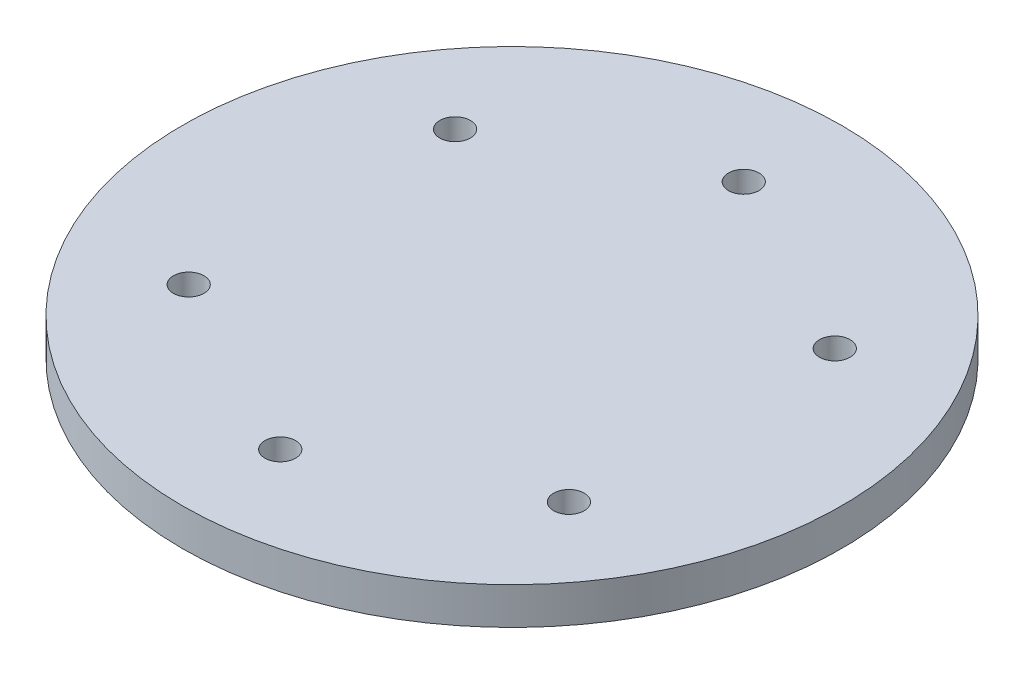
from build123d import *

# Parameters (mm, degrees)
SKETCH1_R           = 35.55
BOSS_EXTRUDE1_DEPTH = 4
SKETCH2_R           = 1.65
CUT_EXTRUDE1_DEPTH  = 10


with BuildPart() as part:
    # Sketch1 → Boss-Extrude1 (new body)
    with BuildSketch(Plane(origin=(0, 0, 0), x_dir=(1, 0, 0), z_dir=(0, 1, 0))):
        Circle(SKETCH1_R)
    extrude(amount=BOSS_EXTRUDE1_DEPTH)

    # Sketch2 → Cut-Extrude1 (cut)
    with BuildSketch(Plane(origin=(0, 4, 0), x_dir=(1, 0, 0), z_dir=(0, 1, 0))):
        with Locations((0, 25)):
            Circle(SKETCH2_R)
        with Locations((-20.478801107, 14.339410909)):
            Circle(SKETCH2_R)
        with Locations((20.478801107, 14.339410909)):
            Circle(SKETCH2_R)
        with Locations((20.478801107, -14.339410909)):
            Circle(SKETCH2_R)
        with Locations((0, -25)):
            Circle(SKETCH2_R)
        with Locations((-20.3386694, -14.537486957)):
            Circle(SKETCH2_R)
    extrude(amount=-CUT_EXTRUDE1_DEPTH, mode=Mode.SUBTRACT)


solid = part.part
